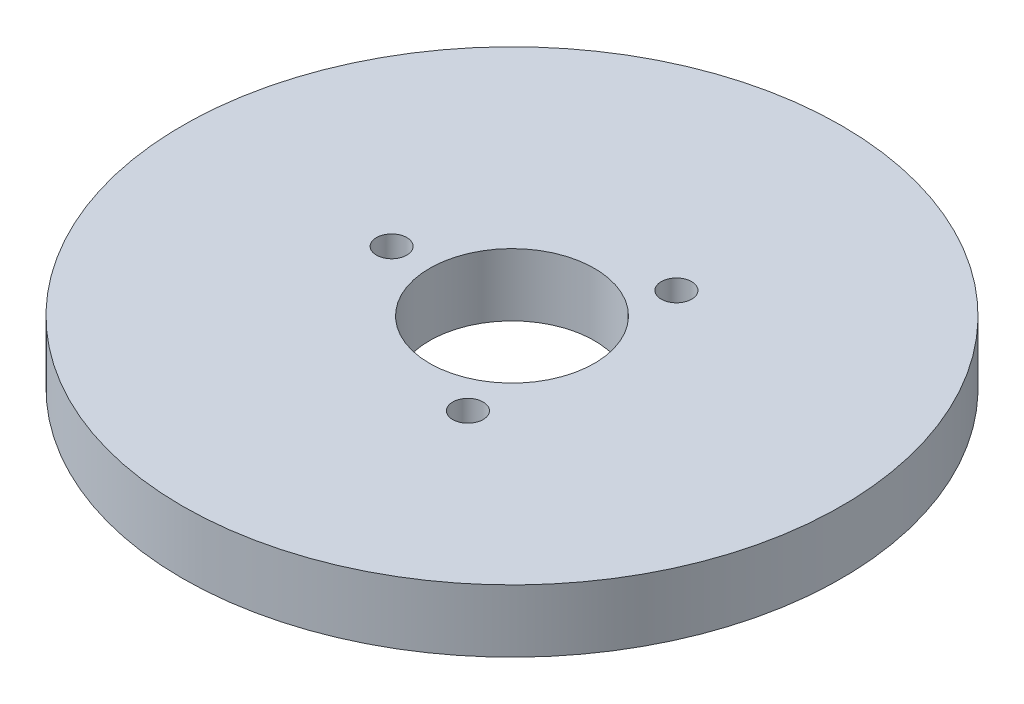
from build123d import *

# Parameters (mm, degrees)
SKETCH1_R           = 100
BOSS_EXTRUDE1_DEPTH = 19
SKETCH2_R           = 25
CUT_EXTRUDE1_DEPTH  = 143.691975948
SKETCH3_R           = 4.622049396
CUT_EXTRUDE2_DEPTH  = 12.660175
CIRPATTERN1_COUNT   = 3


with BuildPart() as part:
    # Sketch1 → Boss-Extrude1 (new body)
    with BuildSketch(Plane(origin=(0, 0, 0), x_dir=(1, 0, 0), z_dir=(0, 1, 0))):
        Circle(SKETCH1_R)
    extrude(amount=BOSS_EXTRUDE1_DEPTH)

    # Sketch2 → Cut-Extrude1 (cut, through all)
    with BuildSketch(Plane(origin=(0, 0, 0), x_dir=(1, 0, 0), z_dir=(0, 1, 0))):
        Circle(SKETCH2_R)
    extrude(amount=CUT_EXTRUDE1_DEPTH, mode=Mode.SUBTRACT)

    # Sketch3 → Cut-Extrude2 (cut)
    with BuildSketch(Plane(origin=(0, 19, 0), x_dir=(1, 0, 0), z_dir=(0, 1, 0))):
        with Locations((-36.525810973, 0)):
            Circle(SKETCH3_R)
    cut_extrude2 = extrude(amount=-CUT_EXTRUDE2_DEPTH, mode=Mode.SUBTRACT)

    # CirPattern1: Cut-Extrude2 ×3 about axis
    cirpattern1_axis = Axis((0, 0, 0), (0, 1, 0))
    for i in range(1, CIRPATTERN1_COUNT):
        add(cut_extrude2.rotate(cirpattern1_axis, i * 360 / CIRPATTERN1_COUNT), mode=Mode.SUBTRACT)


solid = part.part
